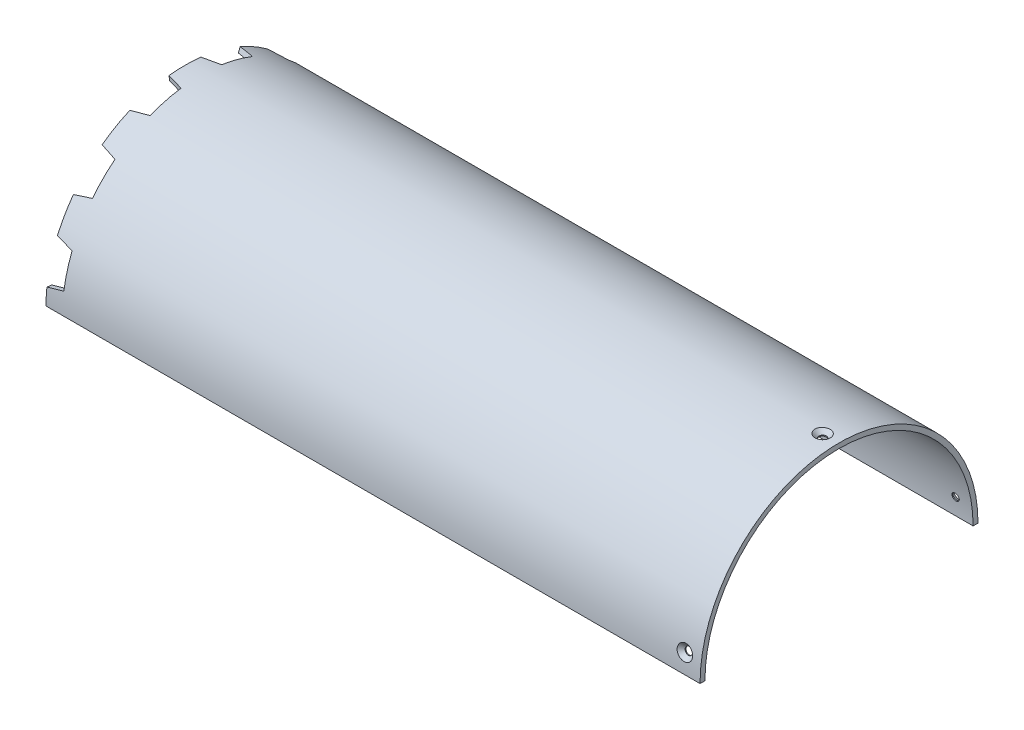
from build123d import *
from build123d.topology import SkipClean

# Parameters (mm, degrees)
SKETCH1_W                      = 390
SKETCH1_H                      = 3
BOSS_EXTRUDE1_DEPTH            = 5
DRAFT1_ANGLE                   = -15
CIRPATTERN1_COUNT              = 12
DRAFT1_OF_CIRPATTERN1_2_ANGLE  = -15
DRAFT1_OF_CIRPATTERN1_3_ANGLE  = -15
DRAFT1_OF_CIRPATTERN1_4_ANGLE  = -15
DRAFT1_OF_CIRPATTERN1_5_ANGLE  = -15
DRAFT1_OF_CIRPATTERN1_6_ANGLE  = -15
DRAFT1_OF_CIRPATTERN1_7_ANGLE  = -15
DRAFT1_OF_CIRPATTERN1_8_ANGLE  = -15
DRAFT1_OF_CIRPATTERN1_9_ANGLE  = -15
DRAFT1_OF_CIRPATTERN1_10_ANGLE = -15
DRAFT1_OF_CIRPATTERN1_11_ANGLE = -15
DRAFT1_OF_CIRPATTERN1_12_ANGLE = -15
SKETCH3_OUTSIDE_W              = 265.338
SKETCH3_OUTSIDE_H              = 265.338
CUT_EXTRUDE1_DEPTH             = 563.983125857


# Read off the part's stored shape, not the designer's step: CSK for M4 Countersunk Flat Head Screw1
with BuildPart() as part:
    # Sketch1 → Revolve1 (revolve)
    with BuildSketch(Plane.XY, mode=Mode.PRIVATE) as revolve1_sk:
        with Locations((355, 83.5)):
            Rectangle(SKETCH1_W, SKETCH1_H)
    revolve(revolve1_sk.sketch.rotate(Axis((0, 0, 0), (1, 0, 0)), 90), axis=Axis((0, 0, 0), (1, 0, 0)))

    # Sketch2 → Boss-Extrude1 (add, symmetric)
    with BuildSketch(Plane(origin=(155, 0, 0), x_dir=(0, 0, -1), z_dir=(1, 0, 0))):
        with BuildLine():
            Line((10.703147762, 81.298478633), (11.094726339, 84.272813217))
            ThreePointArc((11.094726339, 84.272813217), (0, 85), (-11.094726339, 84.272813217))
            Line((-11.094726339, 84.272813217), (-10.703147762, 81.298478633))
            ThreePointArc((-10.703147762, 81.298478633), (0, 82), (10.703147762, 81.298478633))
        make_face()
    boss_extrude1 = extrude(amount=BOSS_EXTRUDE1_DEPTH, both=True)

    # Draft1
    draft1_faces = [part.faces().sort_by_distance(p)[0] for p in [
        (155, 82.785645925, 10.89893705),
        (155, 82.785645925, -10.89893705),
    ]]
    draft(draft1_faces, Plane(origin=(155, 0, 0), x_dir=(0, 0, 1), z_dir=(1, 0, 0)), DRAFT1_ANGLE)

    # CirPattern1: Boss-Extrude1 ×12 about axis
    with SkipClean():  # the faces are left unmerged after this step: merging them gives an invalid solid
        cirpattern1_axis = Axis((0, 0, 0), (1, 0, 0))
        for i in range(1, CIRPATTERN1_COUNT):
            add(boss_extrude1.rotate(cirpattern1_axis, i * 360 / CIRPATTERN1_COUNT))

    # Draft1 of CirPattern1 2
    draft1_of_cirpattern1_2_faces = [part.faces().sort_by_distance(p)[0] for p in [
        (155, 66.245003914, 50.831579322),
        (155, 77.143940965, 31.954066602),
    ]]
    draft(draft1_of_cirpattern1_2_faces, Plane(origin=(155, 0, 0), x_dir=(0, -0.49999999999999994, 0.8660254037844387), z_dir=(1, 0, 0)), DRAFT1_OF_CIRPATTERN1_2_ANGLE)

    # Draft1 of CirPattern1 3
    draft1_of_cirpattern1_3_faces = [part.faces().sort_by_distance(p)[0] for p in [
        (155, 31.954066602, 77.143940965),
        (155, 50.831579322, 66.245003914),
    ]]
    draft(draft1_of_cirpattern1_3_faces, Plane(origin=(155, 0, 0), x_dir=(0, -0.8660254037844386, 0.5000000000000001), z_dir=(1, 0, 0)), DRAFT1_OF_CIRPATTERN1_3_ANGLE)

    # Draft1 of CirPattern1 4
    draft1_of_cirpattern1_4_faces = [part.faces().sort_by_distance(p)[0] for p in [
        (155, -10.89893705, 82.785645925),
        (155, 10.89893705, 82.785645925),
    ]]
    draft(draft1_of_cirpattern1_4_faces, Plane(origin=(155, 0, 0), x_dir=(0, -1, 0), z_dir=(1, 0, 0)), DRAFT1_OF_CIRPATTERN1_4_ANGLE)

    # Draft1 of CirPattern1 5
    draft1_of_cirpattern1_5_faces = [part.faces().sort_by_distance(p)[0] for p in [
        (155, -50.831579322, 66.245003914),
        (155, -31.954066602, 77.143940965),
    ]]
    draft(draft1_of_cirpattern1_5_faces, Plane(origin=(155, 0, 0), x_dir=(0, -0.8660254037844387, -0.4999999999999998), z_dir=(1, 0, 0)), DRAFT1_OF_CIRPATTERN1_5_ANGLE)

    # Draft1 of CirPattern1 6
    draft1_of_cirpattern1_6_faces = [part.faces().sort_by_distance(p)[0] for p in [
        (155, -77.143940965, 31.954066602),
        (155, -66.245003914, 50.831579322),
    ]]
    draft(draft1_of_cirpattern1_6_faces, Plane(origin=(155, 0, 0), x_dir=(0, -0.49999999999999994, -0.8660254037844387), z_dir=(1, 0, 0)), DRAFT1_OF_CIRPATTERN1_6_ANGLE)

    # Draft1 of CirPattern1 7
    draft1_of_cirpattern1_7_faces = [part.faces().sort_by_distance(p)[0] for p in [
        (155, -82.785645925, -10.89893705),
        (155, -82.785645925, 10.89893705),
    ]]
    draft(draft1_of_cirpattern1_7_faces, Plane(origin=(155, 0, 0), x_dir=(0, 0, -1), z_dir=(1, 0, 0)), DRAFT1_OF_CIRPATTERN1_7_ANGLE)

    # Draft1 of CirPattern1 8
    draft1_of_cirpattern1_8_faces = [part.faces().sort_by_distance(p)[0] for p in [
        (155, -66.245003914, -50.831579322),
        (155, -77.143940965, -31.954066602),
    ]]
    draft(draft1_of_cirpattern1_8_faces, Plane(origin=(155, 0, 0), x_dir=(0, 0.5000000000000001, -0.8660254037844386), z_dir=(1, 0, 0)), DRAFT1_OF_CIRPATTERN1_8_ANGLE)

    # Draft1 of CirPattern1 9
    draft1_of_cirpattern1_9_faces = [part.faces().sort_by_distance(p)[0] for p in [
        (155, -31.954066602, -77.143940965),
        (155, -50.831579322, -66.245003914),
    ]]
    draft(draft1_of_cirpattern1_9_faces, Plane(origin=(155, 0, 0), x_dir=(0, 0.8660254037844384, -0.5000000000000004), z_dir=(1, 0, 0)), DRAFT1_OF_CIRPATTERN1_9_ANGLE)

    # Draft1 of CirPattern1 10
    draft1_of_cirpattern1_10_faces = [part.faces().sort_by_distance(p)[0] for p in [
        (155, 10.89893705, -82.785645925),
        (155, -10.89893705, -82.785645925),
    ]]
    draft(draft1_of_cirpattern1_10_faces, Plane.YZ.offset(155), DRAFT1_OF_CIRPATTERN1_10_ANGLE)

    # Draft1 of CirPattern1 11
    draft1_of_cirpattern1_11_faces = [part.faces().sort_by_distance(p)[0] for p in [
        (155, 50.831579322, -66.245003914),
        (155, 31.954066602, -77.143940965),
    ]]
    draft(draft1_of_cirpattern1_11_faces, Plane(origin=(155, 0, 0), x_dir=(0, 0.8660254037844386, 0.5000000000000001), z_dir=(1, 0, 0)), DRAFT1_OF_CIRPATTERN1_11_ANGLE)

    # Draft1 of CirPattern1 12
    draft1_of_cirpattern1_12_faces = [part.faces().sort_by_distance(p)[0] for p in [
        (155, 77.143940965, -31.954066602),
        (155, 66.245003914, -50.831579322),
    ]]
    draft(draft1_of_cirpattern1_12_faces, Plane(origin=(155, 0, 0), x_dir=(0, 0.5000000000000004, 0.8660254037844384), z_dir=(1, 0, 0)), DRAFT1_OF_CIRPATTERN1_12_ANGLE)

    # Sketch3 outside → Cut-Extrude1 (cut, through all)
    with SkipClean():  # the faces are left unmerged after this step: merging them gives an invalid solid
        with BuildSketch(Plane(origin=(0, 0, 0), x_dir=(0, 0, -1), z_dir=(1, 0, 0))):
            Rectangle(SKETCH3_OUTSIDE_W, SKETCH3_OUTSIDE_H)
            with BuildLine():
                Line((0, 0), (-85, 0))
                ThreePointArc((-85, 0), (0, 85), (85, 0))
                Line((85, 0), (0, 0))
            make_face(mode=Mode.SUBTRACT)
        extrude(amount=CUT_EXTRUDE1_DEPTH, mode=Mode.SUBTRACT)

    # CSK for M4 Countersunk Flat Head Scr 2 → CSK for M4 Countersunk Flat Head Screw1 (revolve, cut)
    with SkipClean():  # the faces are left unmerged after this step: merging them gives an invalid solid
        with BuildSketch(Plane(origin=(540, 0, 0), x_dir=(1, 0, 0), z_dir=(0, 0, 1))):
            Polygon((4.700033545, 85.000033545), (0, 85.000033545), (0, 81.96910869), (2.25, 81.96910869), (2.25, 82.55), align=None)
        revolve(axis=Axis((540, 0, 0), (0, 1, 0)), mode=Mode.SUBTRACT)

    # CSK for M4 Countersunk Flat Head Scr 3 o → CSK for M4 Countersunk Flat Head Scr 3 (revolve, cut)
    with SkipClean():  # the faces are left unmerged after this step: merging them gives an invalid solid
        with BuildSketch(Plane(origin=(540, 0, 0), x_dir=(1, 0, 0), z_dir=(0, 0.9914448613738104, 0.13052619222005205))):
            Polygon((4.700071897, 85.000071897), (0, 85.000071897), (0, 81.96910869), (2.25, 81.96910869), (2.25, 82.55), align=None)
        revolve(axis=Axis((540, 0, 0), (0, 0.13052619222005205, -0.9914448613738104)), mode=Mode.SUBTRACT)

    # CSK for M4 Countersunk Flat Head Scr 4 o → CSK for M4 Countersunk Flat Head Scr 4 (revolve, cut)
    with SkipClean():  # the faces are left unmerged after this step: merging them gives an invalid solid
        with BuildSketch(Plane(origin=(540, 0, 0), x_dir=(1, 0, 0), z_dir=(0, -0.9914448613738104, 0.13052619222005205))):
            Polygon((4.700070707, 85.000070707), (0, 85.000070707), (0, 81.96910869), (2.25, 81.96910869), (2.25, 82.55), align=None)
        revolve(axis=Axis((540, 0, 0), (0, 0.13052619222005205, 0.9914448613738104)), mode=Mode.SUBTRACT)


solid = part.part
